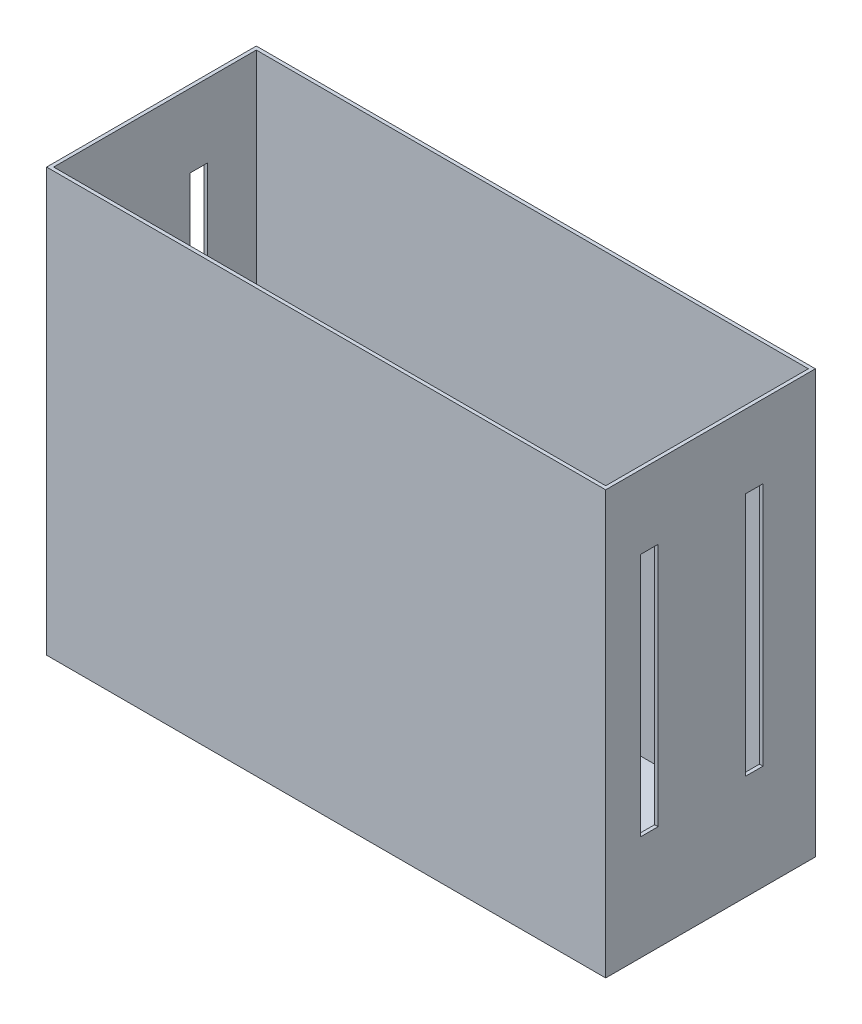
from build123d import *

# Parameters (mm, degrees)
SKETCH1_W               = 406.4
SKETCH1_H               = 152.4
SKETCH1_W_2             = 401.32
SKETCH1_H_2             = 147.32
BOSS_EXTRUDE1_DEPTH     = 304.8
SKETCH2_W               = 406.4
SKETCH2_H               = 152.4
BOSS_EXTRUDE2_DEPTH     = 2.54
CUT_EXTRUDE1_DEPTH      = 514.68320977
CUT_EXTRUDE1_DEPTH_BACK = 514.68320977
SKETCH3_W               = 12.7
SKETCH3_H               = 177.8


with BuildPart() as part:
    # Sketch1 → Boss-Extrude1 (new body)
    with BuildSketch(Plane(origin=(0, 0, 0), x_dir=(1, 0, 0), z_dir=(0, 1, 0))):
        Rectangle(SKETCH1_W, SKETCH1_H)
        Rectangle(SKETCH1_W_2, SKETCH1_H_2, mode=Mode.SUBTRACT)
    extrude(amount=BOSS_EXTRUDE1_DEPTH)

    # Sketch2 → Boss-Extrude2 (add)
    with BuildSketch(Plane.XZ):
        Rectangle(SKETCH2_W, SKETCH2_H)
    extrude(amount=BOSS_EXTRUDE2_DEPTH)

    # Sketch3 → Cut-Extrude1 (cut, two sides: drawn at the far end of the back side and taken through both)
    with BuildSketch(Plane.ZY.offset(203.2).offset(-CUT_EXTRUDE1_DEPTH_BACK)):
        with Locations((44.45, 162.56)):
            Rectangle(SKETCH3_W, SKETCH3_H)
        with Locations((-31.75, 162.56)):
            Rectangle(SKETCH3_W, SKETCH3_H)
    extrude(amount=CUT_EXTRUDE1_DEPTH + CUT_EXTRUDE1_DEPTH_BACK, mode=Mode.SUBTRACT)


solid = part.part
